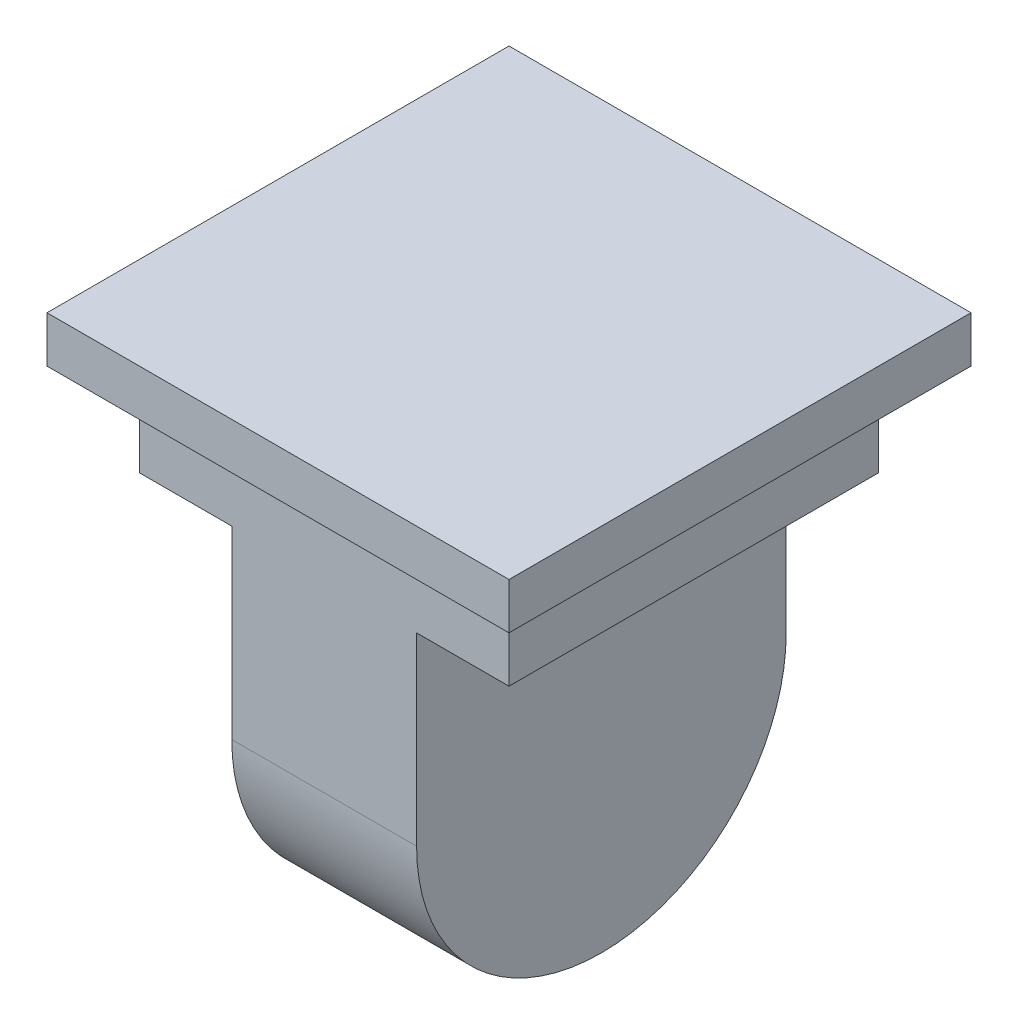
from build123d import *

# Parameters (mm, degrees)
SKETCH_1_W          = 16
SKETCH_1_H          = 16
EXTRUDE_1_DEPTH     = 20
CUT_EXTRUDE_1_DEPTH = 40
CUT_EXTRUDE_START   = -4
CUT_EXTRUDE_2_DEPTH = 4
CUT_EXTRUDE_3_DEPTH = 4
SKETCH_6_W          = 20
SKETCH_6_H          = 20
EXTRUDE_2_DEPTH     = 2


with BuildPart() as part:
    # 草图1 → 凸台-拉伸1 (new body)
    with BuildSketch(Plane(origin=(0, 0, 0), x_dir=(1, 0, 0), z_dir=(0, 1, 0))):
        Rectangle(SKETCH_1_W, SKETCH_1_H)
    extrude(amount=EXTRUDE_1_DEPTH)

    # 草图2 → 切除-拉伸1 (cut)
    with BuildSketch(Plane(origin=(8, 0, 0), x_dir=(0, 0, -1), z_dir=(1, 0, 0))):
        with BuildLine():
            Line((-8, 8), (-8, -6.748551072))
            Line((-8, -6.748551072), (8, -6.748551072))
            Line((8, -6.748551072), (8, 8))
            ThreePointArc((8, 8), (0, 0), (-8, 8))
        make_face()
    extrude(amount=-CUT_EXTRUDE_1_DEPTH, mode=Mode.SUBTRACT)

    # 草图4 → 切除-拉伸2 (cut)
    with BuildSketch(Plane.ZY.offset(8).offset(CUT_EXTRUDE_START)):
        with BuildLine():
            Line((-8, 8), (-8, 16))
            Line((-8, 16), (8, 16))
            Line((8, 16), (8, 8))
            ThreePointArc((8, 8), (0, 0), (-8, 8))
        make_face()
    extrude(amount=CUT_EXTRUDE_2_DEPTH, mode=Mode.SUBTRACT)

    # 草图5 → 切除-拉伸3 (cut)
    with BuildSketch(Plane(origin=(8, 0, 0), x_dir=(0, 0, -1), z_dir=(1, 0, 0))):
        with BuildLine():
            Line((-8, 8), (-8, 16))
            Line((-8, 16), (8, 16))
            Line((8, 16), (8, 8))
            ThreePointArc((8, 8), (0, 0), (-8, 8))
        make_face()
    extrude(amount=-CUT_EXTRUDE_3_DEPTH, mode=Mode.SUBTRACT)

    # 草图6 → 凸台-拉伸2 (add)
    with BuildSketch(Plane(origin=(0, 20, 0), x_dir=(1, 0, 0), z_dir=(0, 1, 0))):
        Rectangle(SKETCH_6_W, SKETCH_6_H)
    extrude(amount=EXTRUDE_2_DEPTH)


solid = part.part
